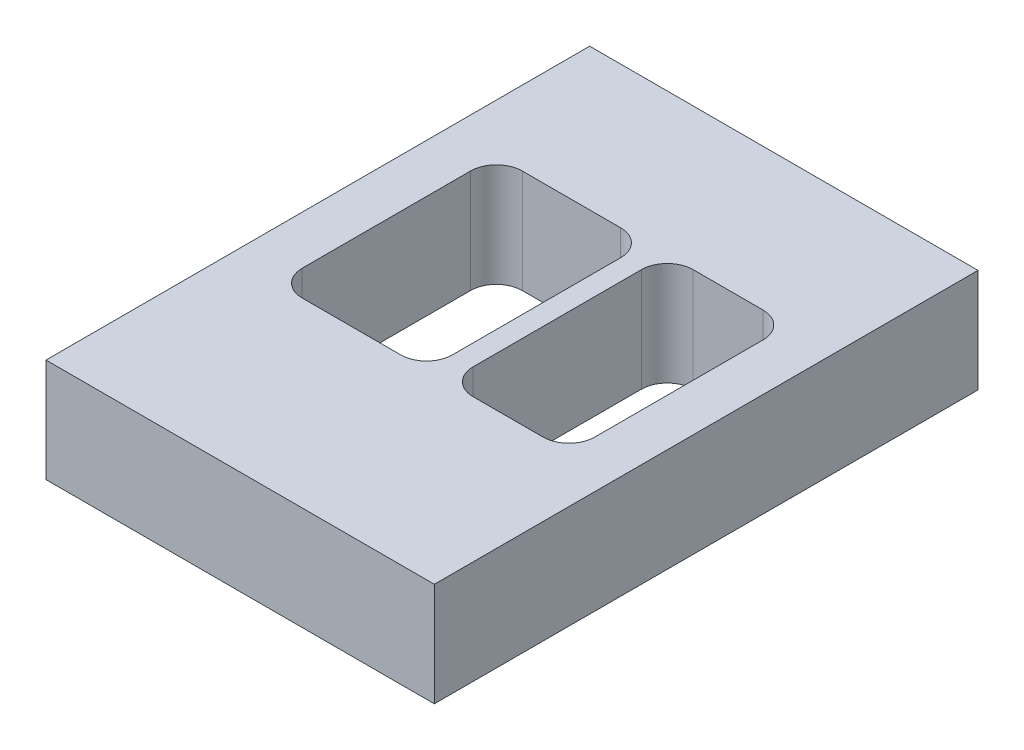
from build123d import *

# Parameters (mm, degrees)
SKETCH1_W           = 150
SKETCH1_H           = 210
BOSS_EXTRUDE1_DEPTH = 40
CUT_EXTRUDE1_REACH  = 137.093
SKETCH3_W           = 58
SKETCH3_H           = 85
SKETCH3_W_2         = 47
FILLET1_R           = 10


with BuildPart() as part:
    # Sketch1 → Boss-Extrude1 (new body)
    with BuildSketch(Plane(origin=(0, 0, 0), x_dir=(1, 0, 0), z_dir=(0, 1, 0))):
        Rectangle(SKETCH1_W, SKETCH1_H)
    extrude(amount=-BOSS_EXTRUDE1_DEPTH)

    # Sketch3 → Cut-Extrude1 (cut, up to next)
    with BuildSketch(Plane(origin=(0, 0, 0), x_dir=(1, 0, 0), z_dir=(0, 1, 0)), mode=Mode.PRIVATE) as cut_extrude1_sk1:
        with Locations((-27.25, 7.73)):
            Rectangle(SKETCH3_W, SKETCH3_H)
    cut_extrude1_tool1 = extrude(cut_extrude1_sk1.sketch, amount=-CUT_EXTRUDE1_REACH, mode=Mode.PRIVATE) & part.part
    # Sketch3 → Cut-Extrude1 (cut, up to next)
    with BuildSketch(Plane(origin=(0, 0, 0), x_dir=(1, 0, 0), z_dir=(0, 1, 0)), mode=Mode.PRIVATE) as cut_extrude1_sk2:
        with Locations((33.25, 7.73)):
            Rectangle(SKETCH3_W_2, SKETCH3_H)
    cut_extrude1_tool2 = extrude(cut_extrude1_sk2.sketch, amount=-CUT_EXTRUDE1_REACH, mode=Mode.PRIVATE) & part.part
    add(cut_extrude1_tool1.solids().sort_by_distance((-27.25, 0, -7.73))[0], mode=Mode.SUBTRACT)
    add(cut_extrude1_tool2.solids().sort_by_distance((33.25, 0, -7.73))[0], mode=Mode.SUBTRACT)

    # Fillet1
    fillet1_edges = [part.edges().sort_by_distance(p)[0] for p in [
        (9.75, -20, -50.23),
        (56.75, -20, 34.77),
        (56.75, -20, -50.23),
        (9.75, -20, 34.77),
        (-56.25, -20, 34.77),
        (1.75, -20, 34.77),
        (1.75, -20, -50.23),
        (-56.25, -20, -50.23),
    ]]
    fillet(fillet1_edges, radius=FILLET1_R)


solid = part.part
